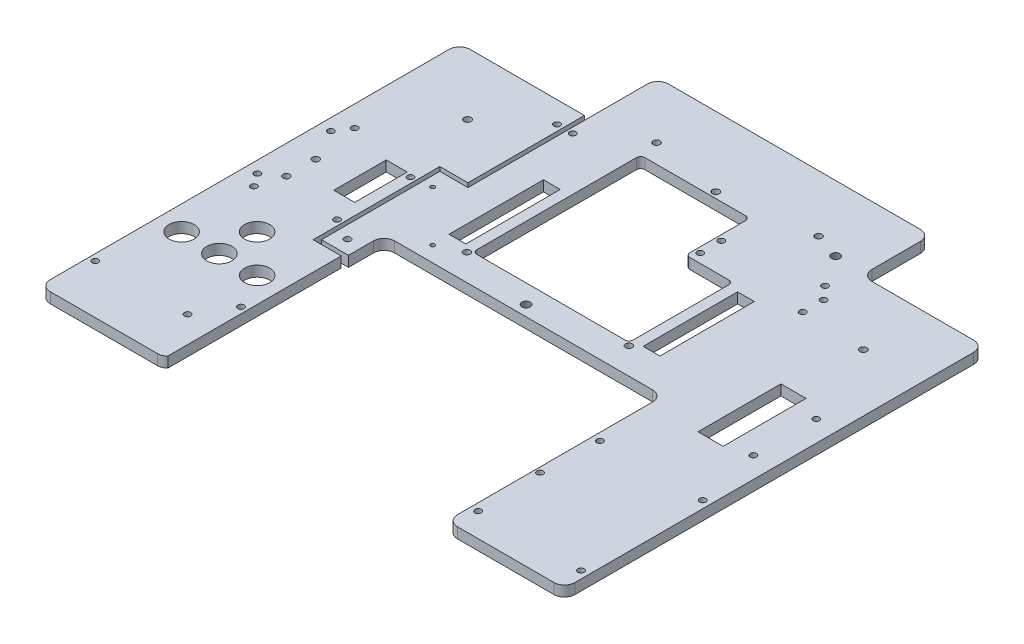
from build123d import *

# Parameters (mm, degrees)
SKETCH_1_W           = 250
SKETCH_1_H           = 200
EXTRUDE_1_DEPTH      = 5
SKETCH_16_R          = 5
CUT_EXTRUDE_11_DEPTH = 11
SKETCH_20_R          = 1.5
CUT_EXTRUDE_15_DEPTH = 15
SKETCH_23_W          = 10
SKETCH_23_H          = 25
CUT_EXTRUDE_18_DEPTH = 10
SKETCH_26_W          = 80
SKETCH_26_H          = 5
EXTRUDE_2_DEPTH      = 33
SKETCH_19_R          = 1.5
CUT_EXTRUDE_14_DEPTH = 15
SKETCH_29_R          = 5
EXTRUDE_5_DEPTH      = 5
SKETCH_30_R          = 1.5
CUT_EXTRUDE_22_DEPTH = 183.589703981
SKETCH_33_R          = 1.5
CUT_EXTRUDE_26_DEPTH = 183.589703981
SKETCH_34_R          = 1.5
CUT_EXTRUDE_27_DEPTH = 10
SKETCH_35_R          = 1.5
CUT_EXTRUDE_28_DEPTH = 10
SKETCH_38_W          = 133
SKETCH_38_H          = 136
CUT_EXTRUDE_31_DEPTH = 10
SKETCH_39_R          = 1.5
CUT_EXTRUDE_32_DEPTH = 183.589703981
SKETCH_40_W          = 21.381304467
SKETCH_40_H          = 33.524264595
SKETCH_40_W_2        = 44.068617219
SKETCH_40_H_2        = 35.466306567
CUT_EXTRUDE_33_DEPTH = 10
FILLET_3_R           = 5
SKETCH_42_W          = 12
SKETCH_42_H          = 39.511138376
CUT_EXTRUDE_35_DEPTH = 10
CUT_EXTRUDE_36_DEPTH = 10
SKETCH_44_R          = 1.5
CUT_EXTRUDE_37_DEPTH = 10
SKETCH_45_R          = 1.5
CUT_EXTRUDE_38_DEPTH = 10
SKETCH_50_R          = 1.5
CUT_EXTRUDE_41_DEPTH = 5
SKETCH_53_R          = 1
SKETCH_53_R_2        = 1.5
CUT_EXTRUDE_44_DEPTH = 5
SKETCH_56_R          = 1.5
CUT_EXTRUDE_46_DEPTH = 10
SKETCH_57_R          = 1.65
CUT_EXTRUDE_48_DEPTH = 5
SKETCH_59_R          = 1.6
CUT_EXTRUDE_50_DEPTH = 5
SKETCH_60_R          = 6
CUT_EXTRUDE_52_DEPTH = 5
SKETCH_61_W          = 33
SKETCH_61_H          = 5
EXTRUDE_7_DEPTH      = 27.922659337
SKETCH_62_W          = 33
SKETCH_62_H          = 5
EXTRUDE_8_DEPTH      = 38.458645
SKETCH_65_R          = 1.6
CUT_EXTRUDE_53_DEPTH = 5
CUT_EXTRUDE_54_DEPTH = 5
FILLET_6_R           = 5
CUT_EXTRUDE_57_DEPTH = 5
FILLET_8_R           = 2
SKETCH_69_W          = 8
SKETCH_69_H          = 45
CUT_EXTRUDE_58_DEPTH = 5


with BuildPart() as part:
    # 草图1 → 凸台-拉伸1 (new body)
    with BuildSketch(Plane(origin=(0, 0, 0), x_dir=(1, 0, 0), z_dir=(0, 1, 0))):
        Rectangle(SKETCH_1_W, SKETCH_1_H)
    extrude(amount=EXTRUDE_1_DEPTH)

    # 草图16 → 切除-拉伸11 (cut)
    with BuildSketch(Plane(origin=(0, 5, 0), x_dir=(1, 0, 0), z_dir=(0, 1, 0))):
        with Locations(Location((-9.5, -74.327812884, 0), (0, 0, 270))):
            Circle(SKETCH_16_R)
    extrude(amount=-CUT_EXTRUDE_11_DEPTH, mode=Mode.SUBTRACT)

    # 草图20 → 切除-拉伸15 (cut)
    with BuildSketch(Plane(origin=(0, 5, 0), x_dir=(1, 0, 0), z_dir=(0, 1, 0))):
        with Locations(Location((-68.353884334, -60.793566597, 0), (0, 0, 270))):
            Circle(SKETCH_20_R)
    extrude(amount=-CUT_EXTRUDE_15_DEPTH, mode=Mode.SUBTRACT)

    # 草图23 → 切除-拉伸18 (cut)
    with BuildSketch(Plane(origin=(0, 5, 0), x_dir=(1, 0, 0), z_dir=(0, 1, 0))):
        with Locations((-89.341476852, 21.910910173)):
            Rectangle(SKETCH_23_W, SKETCH_23_H)
    extrude(amount=-CUT_EXTRUDE_18_DEPTH, mode=Mode.SUBTRACT)

    # 草图26 → 凸台-拉伸2 (add)
    with BuildSketch(Plane(origin=(0, 0, -100), x_dir=(-1, 0, 0), z_dir=(0, 0, -1))):
        with Locations((11.912775293, 2.5)):
            Rectangle(SKETCH_26_W, SKETCH_26_H)
    extrude(amount=EXTRUDE_2_DEPTH)

    # 草图19 → 切除-拉伸14 (cut)
    with BuildSketch(Plane(origin=(0, 5, 0), x_dir=(1, 0, 0), z_dir=(0, 1, 0))):
        with Locations(Location((115, 30, 0), (0, 0, 270))):
            Circle(SKETCH_19_R)
        with Locations(Location((115, 0, 0), (0, 0, 270))):
            Circle(SKETCH_19_R)
        with Locations(Location((-115, 40, 0), (0, 0, 270))):
            Circle(SKETCH_19_R)
        with Locations(Location((-115, -8, 0), (0, 0, 270))):
            Circle(SKETCH_19_R)
        with Locations(Location((62.145255031, -58, 0), (0, 0, 270))):
            Circle(SKETCH_19_R)
    extrude(amount=-CUT_EXTRUDE_14_DEPTH, mode=Mode.SUBTRACT)

    # 草图29 → 凸台-拉伸5 (add)
    with BuildSketch(Plane(origin=(0, 5, 0), x_dir=(1, 0, 0), z_dir=(0, 1, 0))):
        with Locations((-9.5, -74.327812884)):
            Circle(SKETCH_29_R)
    extrude(amount=-EXTRUDE_5_DEPTH)

    # 草图30 → 切除-拉伸22 (cut, through all)
    with BuildSketch(Plane(origin=(0, 5, 0), x_dir=(1, 0, 0), z_dir=(0, 1, 0))):
        with Locations(Location((38.011637907, -60, 0), (0, 0, 270))):
            Circle(SKETCH_30_R)
        with Locations(Location((35.309361312, -73.585261849, 0), (0, 0, 270))):
            Circle(SKETCH_30_R)
        with Locations(Location((27.61392864, -85.102290732, 0), (0, 0, 270))):
            Circle(SKETCH_30_R)
        with Locations(Location((16.096899756, -92.797723404, 0), (0, 0, 270))):
            Circle(SKETCH_30_R)
        with Locations(Location((2.511637907, -95.5, 0), (0, 0, 270))):
            Circle(SKETCH_30_R)
        with Locations(Location((-11.073623941, -92.797723404, 0), (0, 0, 270))):
            Circle(SKETCH_30_R)
        with Locations(Location((-22.590652825, -85.102290732, 0), (0, 0, 270))):
            Circle(SKETCH_30_R)
        with Locations(Location((-30.286085497, -73.585261849, 0), (0, 0, 270))):
            Circle(SKETCH_30_R)
        with Locations(Location((-32.988362093, -60, 0), (0, 0, 270))):
            Circle(SKETCH_30_R)
        with Locations(Location((-30.286085497, -46.414738151, 0), (0, 0, 270))):
            Circle(SKETCH_30_R)
        with Locations(Location((-22.590652825, -34.897709268, 0), (0, 0, 270))):
            Circle(SKETCH_30_R)
        with Locations(Location((-11.073623941, -27.202276596, 0), (0, 0, 270))):
            Circle(SKETCH_30_R)
        with Locations(Location((2.511637907, -24.5, 0), (0, 0, 270))):
            Circle(SKETCH_30_R)
        with Locations(Location((16.096899756, -27.202276596, 0), (0, 0, 270))):
            Circle(SKETCH_30_R)
        with Locations(Location((27.61392864, -34.897709268, 0), (0, 0, 270))):
            Circle(SKETCH_30_R)
        with Locations(Location((35.309361312, -46.414738151, 0), (0, 0, 270))):
            Circle(SKETCH_30_R)
    extrude(amount=-CUT_EXTRUDE_22_DEPTH, mode=Mode.SUBTRACT)

    # 草图33 → 切除-拉伸26 (cut, through all)
    with BuildSketch(Plane(origin=(0, 5, 0), x_dir=(1, 0, 0), z_dir=(0, 1, 0))):
        with Locations(Location((67.652849671, 70.854820312, 0), (0, 0, 270))):
            Circle(SKETCH_33_R)
        with Locations(Location((67.652849671, 80.854820312, 0), (0, 0, 270))):
            Circle(SKETCH_33_R)
        with Locations(Location((18.852849671, 80.854820312, 0), (0, 0, 270))):
            Circle(SKETCH_33_R)
        with Locations(Location((18.852849671, 70.854820312, 0), (0, 0, 270))):
            Circle(SKETCH_33_R)
    extrude(amount=-CUT_EXTRUDE_26_DEPTH, mode=Mode.SUBTRACT)

    # 草图34 → 切除-拉伸27 (cut)
    with BuildSketch(Plane(origin=(0, 5, 0), x_dir=(1, 0, 0), z_dir=(0, 1, 0))):
        with Locations(Location((-122, -76.6, 0), (0, 0, 270))):
            Circle(SKETCH_34_R)
        with Locations(Location((-78, -76.6, 0), (0, 0, 270))):
            Circle(SKETCH_34_R)
    extrude(amount=-CUT_EXTRUDE_27_DEPTH, mode=Mode.SUBTRACT)

    # 草图35 → 切除-拉伸28 (cut)
    with BuildSketch(Plane(origin=(0, 5, 0), x_dir=(1, 0, 0), z_dir=(0, 1, 0))):
        with Locations(Location((-68.353884334, 89.793566597, 0), (0, 0, 270))):
            Circle(SKETCH_35_R)
        with Locations(Location((62.145255031, 87, 0), (0, 0, 270))):
            Circle(SKETCH_35_R)
    extrude(amount=-CUT_EXTRUDE_28_DEPTH, mode=Mode.SUBTRACT)

    # 草图38 → 切除-拉伸31 (cut)
    with BuildSketch(Plane(origin=(0, 5, 0), x_dir=(1, 0, 0), z_dir=(0, 1, 0))):
        with Locations((2.511637907, -65)):
            Rectangle(SKETCH_38_W, SKETCH_38_H)
    extrude(amount=-CUT_EXTRUDE_31_DEPTH, mode=Mode.SUBTRACT)

    # 草图39 → 切除-拉伸32 (cut, through all)
    with BuildSketch(Plane(origin=(0, 5, 0), x_dir=(1, 0, 0), z_dir=(0, 1, 0))):
        with Locations(Location((71.352890761, -58, 0), (0, 0, 270))):
            Circle(SKETCH_39_R)
    extrude(amount=-CUT_EXTRUDE_32_DEPTH, mode=Mode.SUBTRACT)

    # 草图40 → 切除-拉伸33 (cut)
    with BuildSketch(Plane(origin=(0, 5, 0), x_dir=(1, 0, 0), z_dir=(0, 1, 0))):
        with Locations((-46.22212306, 116.762132298)):
            Rectangle(SKETCH_40_W, SKETCH_40_H)
        with Locations((62.589055251, 117.733153284)):
            Rectangle(SKETCH_40_W_2, SKETCH_40_H_2)
    extrude(amount=-CUT_EXTRUDE_33_DEPTH, mode=Mode.SUBTRACT)

    # 圆角3
    fillet_3_edges = [part.edges().sort_by_distance(p)[0] for p in [
        (69.011637907, 2.5, 100),
        (69.011637907, 2.5, -3),
        (-63.988362093, 2.5, 100),
        (-63.988362093, 2.5, -3),
        (125, 2.5, 100),
        (-125, 2.5, 100),
        (-125, 2.5, -100),
        (125, 2.5, -100),
    ]]
    fillet(fillet_3_edges, radius=FILLET_3_R)

    # 草图42 → 切除-拉伸35 (cut)
    with BuildSketch(Plane(origin=(0, 5, 0), x_dir=(1, 0, 0), z_dir=(0, 1, 0))):
        with Locations((98.103934789, 16.274145881)):
            Rectangle(SKETCH_42_W, SKETCH_42_H)
    extrude(amount=-CUT_EXTRUDE_35_DEPTH, mode=Mode.SUBTRACT)

    # 草图43 → 切除-拉伸36 (cut)
    with BuildSketch(Plane(origin=(0, 5, 0), x_dir=(1, 0, 0), z_dir=(0, 1, 0))):
        Polygon((-65.454130163, 100), (-65.454130163, 44.465322203), (-78.855525146, 44.465322203), (-78.855525146, -15.933068336), (-65.454130163, -15.933068336), (-65.454130163, -100.006991686), (-63.454130163, -100.006991686), (-63.454130163, -13.933068336), (-76.855525146, -13.933068336), (-76.855525146, 42.465322203), (-63.454130163, 42.465322203), (-63.454130163, 100), align=None)
    extrude(amount=-CUT_EXTRUDE_36_DEPTH, mode=Mode.SUBTRACT)


with BuildPart() as cut_extrude_36_piece_1:
    # of the separate pieces the step leaves, piece 1, a body of its own (cut_extrude_36_pieces)
    add(part.part.solids().sort_by_distance((-63.454130163, 5, -100))[0])

    # 草图44 → 切除-拉伸37 (cut)
    with BuildSketch(Plane(origin=(0, 5, 0), x_dir=(1, 0, 0), z_dir=(0, 1, 0))):
        with Locations(Location((-60.864682609, 89.793566597, 0), (0, 0, 270))):
            Circle(SKETCH_44_R)
    extrude(amount=-CUT_EXTRUDE_37_DEPTH, mode=Mode.SUBTRACT)

    # 草图45 → 切除-拉伸38 (cut)
    with BuildSketch(Plane(origin=(0, 5, 0), x_dir=(1, 0, 0), z_dir=(0, 1, 0))):
        with Locations(Location((-70.874244833, -7.534328491, 0), (0, 0, 270))):
            Circle(SKETCH_45_R)
    extrude(amount=-CUT_EXTRUDE_38_DEPTH, mode=Mode.SUBTRACT)

    # 草图50 → 切除-拉伸41 (cut)
    with BuildSketch(Plane(origin=(0, 5, 0), x_dir=(1, 0, 0), z_dir=(0, 1, 0))):
        with Locations(Location((-0.072615935, 51.462867156, 0), (0, 0, 270))):
            Circle(SKETCH_50_R)
    extrude(amount=-CUT_EXTRUDE_41_DEPTH, mode=Mode.SUBTRACT)


with BuildPart() as cut_extrude_36_piece_2:
    # of the separate pieces the step leaves, piece 2, a body of its own (cut_extrude_36_pieces)
    add(part.part.solids().sort_by_distance((-120, 0, -100))[0])


with BuildPart() as cut_extrude_44_tool:
    # 草图53 → 切除-拉伸44 (new body)
    with BuildSketch(Plane(origin=(0, 5, 0), x_dir=(1, 0, 0), z_dir=(0, 1, 0))):
        with Locations(Location((-72.118454967, 34.317741468, 0), (0, 0, 270))):
            Circle(SKETCH_53_R)
        with Locations(Location((-48.118454967, 10.317741468, 0), (0, 0, 270))):
            Circle(SKETCH_53_R)
        with Locations(Location((-119.441436652, 33.090151529, 0), (0, 0, 270))):
            Circle(SKETCH_53_R_2)
        with Locations(Location((-119.441436652, -1.909848471, 0), (0, 0, 270))):
            Circle(SKETCH_53_R_2)
        with Locations(Location((-81.441436652, -1.909848471, 0), (0, 0, 270))):
            Circle(SKETCH_53_R_2)
        with Locations(Location((-81.441436652, 33.090151529, 0), (0, 0, 270))):
            Circle(SKETCH_53_R_2)
    extrude(amount=-CUT_EXTRUDE_44_DEPTH)


with BuildPart() as cut_extrude_36_piece_1_1:
    add(cut_extrude_36_piece_1.part)

    # 切除-拉伸44: cut by cut_extrude_44_tool
    add(cut_extrude_44_tool.part, mode=Mode.SUBTRACT)

    # 草图56 → 切除-拉伸46 (cut)
    with BuildSketch(Plane(origin=(0, 5, 0), x_dir=(1, 0, 0), z_dir=(0, 1, 0))):
        with Locations(Location((72.5, -30.611943243, 0), (0, 0, 270))):
            Circle(SKETCH_56_R)
        with Locations(Location((121.5, -30.611943243, 0), (0, 0, 270))):
            Circle(SKETCH_56_R)
        with Locations(Location((72.5, -88.611943243, 0), (0, 0, 270))):
            Circle(SKETCH_56_R)
        with Locations(Location((121.5, -88.611943243, 0), (0, 0, 270))):
            Circle(SKETCH_56_R)
    extrude(amount=-CUT_EXTRUDE_46_DEPTH, mode=Mode.SUBTRACT)


with BuildPart() as cut_extrude_36_piece_2_1:
    add(cut_extrude_36_piece_2.part)

    # 切除-拉伸44: cut by cut_extrude_44_tool
    add(cut_extrude_44_tool.part, mode=Mode.SUBTRACT)


with BuildPart() as cut_extrude_48_tool:
    # 草图57 → 切除-拉伸48 (new body)
    with BuildSketch(Plane(origin=(0, 5, 0), x_dir=(1, 0, 0), z_dir=(0, 1, 0))):
        with Locations(Location((-91.663866667, 70.484221732, 0), (0, 0, 270))):
            Circle(SKETCH_57_R)
        with Locations(Location((-2.72049869, 99.833332382, 0), (0, 0, 270))):
            Circle(SKETCH_57_R)
        with Locations(Location((97.615241729, 69.834359642, 0), (0, 0, 270))):
            Circle(SKETCH_57_R)
    extrude(amount=-CUT_EXTRUDE_48_DEPTH)


with BuildPart() as cut_extrude_36_piece_1_2:
    add(cut_extrude_36_piece_1_1.part)

    # 切除-拉伸48: cut by cut_extrude_48_tool
    add(cut_extrude_48_tool.part, mode=Mode.SUBTRACT)

    # 草图61 → 凸台-拉伸7 (add)
    with BuildSketch(Plane.ZY.offset(35.531470826)):
        with Locations((-116.5, 2.5)):
            Rectangle(SKETCH_61_W, SKETCH_61_H)
    extrude(amount=EXTRUDE_7_DEPTH)

    # 草图62 → 凸台-拉伸8 (add)
    with BuildSketch(Plane(origin=(28.087224707, 0, 0), x_dir=(0, 0, -1), z_dir=(1, 0, 0))):
        with Locations((116.5, 2.5)):
            Rectangle(SKETCH_62_W, SKETCH_62_H)
    extrude(amount=EXTRUDE_8_DEPTH)

    # 草图65 → 切除-拉伸53 (cut)
    with BuildSketch(Plane(origin=(0, 5, 0), x_dir=(1, 0, 0), z_dir=(0, 1, 0))):
        with Locations(Location((40.145869837, 105.95, 0), (0, 0, 270))):
            Circle(SKETCH_65_R)
        with Locations(Location((-37.054130163, 105.95, 0), (0, 0, 270))):
            Circle(SKETCH_65_R)
        with Locations(Location((40.145869837, 15.55, 0), (0, 0, 270))):
            Circle(SKETCH_65_R)
        with Locations(Location((-37.054130163, 15.55, 0), (0, 0, 270))):
            Circle(SKETCH_65_R)
    extrude(amount=-CUT_EXTRUDE_53_DEPTH, mode=Mode.SUBTRACT)

    # 草图66 → 切除-拉伸54 (cut)
    with BuildSketch(Plane(origin=(0, 5, 0), x_dir=(1, 0, 0), z_dir=(0, 1, 0))):
        Polygon((-1.79694331, 6.108213124), (-1.762878179, 6.10065784), (-1.728667232, 6.093703474), (-1.694342338, 6.087334848), (-1.659919017, 6.081575686), (-1.625388998, 6.076417494), (-1.590782072, 6.071861367), (-1.556098711, 6.067906845), (-1.521361624, 6.064562147), (-1.486556848, 6.061826853), (-1.451721729, 6.059694009), (-1.416847788, 6.058170953), (-1.381957838, 6.05725822), (-1.347029531, 6.056955281), (-1.312140827, 6.057248035), (-1.277251642, 6.058174137), (-1.242369932, 6.059695506), (-1.207535176, 6.061820117), (-1.172735996, 6.064563186), (-1.13800006, 6.067910177), (-1.10330875, 6.07186038), (-1.068701644, 6.076414317), (-1.034171754, 6.08157213), (-0.999754467, 6.087334288), (-0.965430228, 6.09370053), (-0.931227643, 6.10065587), (-0.897131611, 6.10821524), (-0.863197841, 6.116356795), (-0.829399027, 6.125102757), (-0.795775614, 6.134423394), (-0.762313797, 6.14434134), (-0.729010618, 6.154833739), (-0.695899969, 6.165908489), (-0.663000941, 6.177565844), (-0.630302559, 6.189790524), (-0.597838814, 6.20258298), (-0.565573387, 6.215942728), (-0.533584706, 6.229855443), (-0.501807745, 6.244343312), (-0.470298988, 6.259360981), (-0.439070132, 6.274939575), (-0.408111242, 6.291055676), (-0.377418121, 6.307709694), (-0.347037802, 6.324901787), (-0.31696164, 6.342616706), (-0.287216174, 6.360854802), (-0.257757737, 6.379608044), (-0.228660825, 6.398877422), (-0.199904331, 6.418639369), (-0.171470717, 6.438916939), (-0.143408814, 6.459680042), (-0.115721881, 6.480928955), (-0.088402102, 6.50265589), (-0.061469403, 6.524868329), (-0.034927077, 6.547528827), (-0.008781242, 6.570667503), (0.016960611, 6.594246269), (0.042267855, 6.618273447), (0.067178104, 6.642740856), (0.091628764, 6.667634189), (0.115661735, 6.692952425), (0.139243861, 6.718688786), (0.162370284, 6.744827968), (0.185051815, 6.771377511), (0.20725369, 6.798314825), (0.228981761, 6.825624463), (0.250221337, 6.853322454), (0.270980852, 6.881377484), (0.291268328, 6.909797597), (0.31102815, 6.938567929), (0.33030063, 6.967673043), (0.349052702, 6.997112912), (0.36728836, 7.026872581), (0.384995857, 7.056944287), (0.402199978, 7.087335621), (0.418847599, 7.118009097), (0.434975966, 7.148963758), (0.450532108, 7.180208687), (0.465561248, 7.211712549), (0.480042893, 7.243475149), (0.493974256, 7.275496992), (0.507310026, 7.307732572), (0.520126145, 7.340219536), (0.532342375, 7.372912378), (0.543998773, 7.405811498), (0.555077631, 7.4389162), (0.565560495, 7.472204374), (0.575479033, 7.505676066), (0.584794742, 7.539307571), (0.593544525, 7.573107246), (0.601693052, 7.607044826), (0.609246934, 7.641127206), (0.616197495, 7.67533215), (0.622567444, 7.709651437), (0.628326888, 7.744078481), (0.633485031, 7.778604774), (0.638046696, 7.813207901), (0.641999404, 7.847895012), (0.645347884, 7.88263624), (0.648079753, 7.917446185), (0.650216303, 7.952279857), (0.651740965, 7.987151914), (0.652650279, 8.022047498), (0.652954747, 8.056950637), (0.652650557, 8.091854861), (0.651734232, 8.126743916), (0.650216594, 8.161626042), (0.648072912, 8.196462448), (0.645341018, 8.23126148), (0.642005796, 8.26600704), (0.638055514, 8.300692296), (0.633492196, 8.335294404), (0.628326645, 8.369820206), (0.622558564, 8.404247351), (0.616204145, 8.438567707), (0.609246987, 8.472773577), (0.601685035, 8.506850549), (0.593545755, 8.540797794), (0.584801739, 8.574585405), (0.575471811, 8.608228035), (0.565561155, 8.641695344), (0.555086162, 8.674994101), (0.543999782, 8.708088139), (0.532334793, 8.740990994), (0.520119401, 8.773687389), (0.507310105, 8.806163001), (0.493965567, 8.838416583), (0.480051036, 8.870426245), (0.465568832, 8.902191489), (0.450539705, 8.933696671), (0.434976502, 8.964927186), (0.41883937, 8.995897998), (0.40220044, 9.026569963), (0.385002551, 9.056952221), (0.367295414, 9.087035731), (0.349053483, 9.116790561), (0.330300251, 9.146232234), (0.311028877, 9.175336623), (0.291261264, 9.204104835), (0.270989286, 9.232521144), (0.250222151, 9.260577511), (0.228983041, 9.288266178), (0.207246818, 9.315587943), (0.185043539, 9.342526574), (0.16237776, 9.369074559), (0.139244517, 9.395208679), (0.115661819, 9.420952447), (0.091631014, 9.44626719), (0.067178847, 9.471167923), (0.042268698, 9.495632311), (0.016961556, 9.519659081), (-0.008780386, 9.543241747), (-0.034925112, 9.566371504), (-0.061476905, 9.589041421), (-0.088400942, 9.611243587), (-0.115714562, 9.632969848), (-0.143415897, 9.654220645), (-0.171469193, 9.674988053), (-0.199897009, 9.695256538), (-0.228659768, 9.715025574), (-0.257764546, 9.734288269), (-0.287206687, 9.753044563), (-0.316970112, 9.771277942), (-0.347045284, 9.789005045), (-0.377417731, 9.806193547), (-0.408110248, 9.822845146), (-0.43906361, 9.838966044), (-0.470304096, 9.854541221), (-0.501806095, 9.869570336), (-0.533584142, 9.884046132), (-0.565573508, 9.897968216), (-0.597829918, 9.911313576), (-0.630301745, 9.924112264), (-0.663000461, 9.936342078), (-0.69590672, 9.947986927), (-0.729017524, 9.959062141), (-0.762305966, 9.969559911), (-0.795767488, 9.979472725), (-0.829397442, 9.988800057), (-0.86320281, 9.997541998), (-0.89713071, 10.005682945), (-0.93122647, 10.013246319), (-0.965429501, 10.02020058), (-0.999746945, 10.026569107), (-1.034177713, 10.032328601), (-1.068702151, 10.037486253), (-1.103316521, 10.042042945), (-1.137992438, 10.045996902), (-1.172735572, 10.049342147), (-1.2075342, 10.052084577), (-1.242361967, 10.054209872), (-1.277251277, 10.055732899), (-1.312148674, 10.056645964), (-1.347036937, 10.056948372), (-1.381956005, 10.056648569), (-1.416845091, 10.055729917), (-1.451711902, 10.05420835), (-1.486548619, 10.052076315), (-1.521360738, 10.049340868), (-1.556097139, 10.045993883), (-1.590780534, 10.042043576), (-1.625395654, 10.037482293), (-1.659917632, 10.032324142), (-1.694350185, 10.026569639), (-1.728666971, 10.02020353), (-1.762869091, 10.013248184), (-1.796942307, 10.005688511), (-1.830878507, 9.997539305), (-1.864682807, 9.988801099), (-1.898321588, 9.979480434), (-1.931792715, 9.969562843), (-1.965070747, 9.959070345), (-1.998168361, 9.947995189), (-2.031088339, 9.936338344), (-2.063781134, 9.92411359), (-2.096265934, 9.91131373), (-2.128508446, 9.897961128), (-2.160521907, 9.884041058), (-2.192283296, 9.869568583), (-2.22377736, 9.854535118), (-2.255019049, 9.838972063), (-2.285987354, 9.822848403), (-2.316663713, 9.806194163), (-2.347036113, 9.789002197), (-2.377104828, 9.771286947), (-2.406889973, 9.753041693), (-2.436323632, 9.734295806), (-2.465438, 9.715026893), (-2.494192734, 9.695257238), (-2.522605061, 9.67498707), (-2.550672786, 9.654223811), (-2.578359953, 9.632974901), (-2.605689143, 9.61124064), (-2.632620011, 9.589043312), (-2.659154623, 9.566367577), (-2.685310032, 9.543244396), (-2.711042448, 9.519657355), (-2.736364591, 9.495630374), (-2.761252153, 9.471170582), (-2.785727593, 9.446269893), (-2.809745198, 9.420951453), (-2.833343022, 9.395207849), (-2.856474799, 9.369068738), (-2.87912573, 9.342526473), (-2.901335291, 9.315589029), (-2.923063697, 9.288271711), (-2.944312484, 9.260581526), (-2.96507955, 9.232518912), (-2.985342243, 9.204106387), (-3.005117332, 9.175343709), (-3.024374545, 9.146230941), (-3.043143612, 9.116791297), (-3.061377408, 9.087031604), (-3.079092693, 9.056952084), (-3.096274126, 9.026568367), (-3.112936647, 8.995895088), (-3.129042204, 8.964939659), (-3.144628844, 8.933695135), (-3.159660073, 8.902191766), (-3.174147411, 8.870421324), (-3.18806367, 8.838414649), (-3.201406995, 8.806171252), (-3.214209838, 8.773684578), (-3.226431895, 8.740991347), (-3.238074882, 8.708085064), (-3.249151785, 8.674987322), (-3.25965733, 8.641691998), (-3.269568179, 8.608220669), (-3.278899493, 8.574588906), (-3.287635674, 8.540796501), (-3.295782664, 8.506851915), (-3.303343665, 8.472777081), (-3.310301908, 8.438572239), (-3.316656963, 8.404252288), (-3.322431639, 8.369817996), (-3.327581761, 8.335299512), (-3.332128625, 8.300688738), (-3.336081002, 8.266009074), (-3.339439358, 8.231260526), (-3.342170797, 8.196465478), (-3.344305584, 8.161624331), (-3.345816975, 8.126752098), (-3.346731877, 8.091856588), (-3.347038214, 8.056953008), (-3.346732387, 8.022049229), (-3.345815935, 7.987152255), (-3.344306108, 7.952278149), (-3.342162094, 7.91744919), (-3.339445769, 7.882634996), (-3.336089496, 7.847896609), (-3.332137351, 7.813211327), (-3.327590888, 7.778602457), (-3.322425238, 7.744084106), (-3.316665404, 7.709649619), (-3.310302837, 7.675329154), (-3.303336041, 7.641130143), (-3.295791881, 7.607045955), (-3.287635041, 7.573105928), (-3.278883104, 7.539318678), (-3.269568541, 7.505676252), (-3.259650668, 7.472208847), (-3.249160217, 7.438916871), (-3.238073697, 7.405815846), (-3.226431756, 7.372913296), (-3.214216603, 7.340216438), (-3.201414856, 7.307733476), (-3.188056716, 7.275487164), (-3.1741479, 7.243485495), (-3.159660208, 7.211712727), (-3.144628992, 7.180207051), (-3.129050522, 7.148968883), (-3.112930414, 7.118013665), (-3.096266806, 7.087341373), (-3.079101714, 7.056944181), (-3.061376913, 7.026875805), (-3.043142665, 6.997121077), (-3.024383711, 6.967671877), (-3.005126079, 6.938567205), (-2.985343097, 6.909799021), (-2.965086351, 6.881375463), (-2.944311664, 6.85332668), (-2.923057061, 6.825629891), (-2.901328518, 6.798308461), (-2.879127232, 6.77137754), (-2.856474724, 6.744829731), (-2.833343349, 6.71869517), (-2.809745515, 6.692951434), (-2.78572798, 6.667636867), (-2.761252765, 6.642735829), (-2.736365429, 6.618271976), (-2.711043157, 6.594244773), (-2.685302973, 6.570670046), (-2.659163939, 6.547532448), (-2.632621927, 6.524862428), (-2.605690437, 6.502660396), (-2.578369236, 6.480926351), (-2.550665704, 6.459683208), (-2.522604955, 6.438915934), (-2.494186349, 6.418655256), (-2.465431713, 6.398870727), (-2.436316924, 6.379607898), (-2.406882593, 6.360859625), (-2.377113689, 6.342618024), (-2.347038409, 6.324899069), (-2.316665969, 6.307710102), (-2.2859945, 6.291051563), (-2.255027998, 6.274938175), (-2.223777269, 6.259362862), (-2.192291002, 6.244341407), (-2.16051492, 6.229857953), (-2.128500305, 6.215943451), (-2.096251913, 6.202590513), (-2.063781951, 6.189791617), (-2.03108882, 6.177562111), (-1.998176511, 6.165916948), (-1.96507921, 6.154841913), (-1.931785646, 6.144344075), (-1.898329344, 6.134423879), (-1.864684491, 6.12509635), (-1.830871006, 6.116369436), align=None)
        Polygon((50.500860049, 101.188897297), (50.511936987, 101.155793605), (50.523594061, 101.122890855), (50.535812644, 101.090189294), (50.548611758, 101.057718475), (50.561953956, 101.025463992), (50.57588443, 100.993462502), (50.590354459, 100.961692297), (50.605390514, 100.930182831), (50.620959268, 100.898949448), (50.63708307, 100.867991853), (50.653735648, 100.837295491), (50.670921814, 100.806942261), (50.688636854, 100.776857715), (50.706881559, 100.747101451), (50.725629756, 100.717666365), (50.744896344, 100.68855226), (50.764674171, 100.659781584), (50.784937258, 100.631362132), (50.805707958, 100.60329361), (50.826956865, 100.57560621), (50.84868388, 100.548292484), (50.870881553, 100.521352531), (50.893557828, 100.4948235), (50.916678588, 100.468661137), (50.940267171, 100.442939646), (50.964293184, 100.41761472), (50.988760944, 100.392731012), (51.01365496, 100.368244018), (51.038979746, 100.344213289), (51.064716776, 100.320646521), (51.09085448, 100.297514064), (51.117397078, 100.274853117), (51.144336625, 100.252626529), (51.171644211, 100.230901745), (51.199342087, 100.209671019), (51.227403683, 100.188897446), (51.255825869, 100.168625777), (51.284578942, 100.148863855), (51.313692505, 100.129596386), (51.343133429, 100.110853613), (51.37289377, 100.092598387), (51.402970493, 100.074882906), (51.433355952, 100.057692369), (51.464028094, 100.041049422), (51.494982797, 100.024924315), (51.526227809, 100.009339299), (51.557741076, 99.99431702), (51.589503578, 99.979827924), (51.621500909, 99.96590946), (51.653751694, 99.952561381), (51.686233386, 99.939769082), (51.718931183, 99.927540212), (51.751837932, 99.915897219), (51.784938536, 99.9048254), (51.818232994, 99.894324757), (51.851702879, 99.884410434), (51.885344665, 99.875097382), (51.919135506, 99.866348648), (51.953072173, 99.858201531), (51.987147214, 99.850656128), (52.021360039, 99.843667741), (52.055670856, 99.837326313), (52.090104754, 99.831556997), (52.124632426, 99.82639744), (52.159235149, 99.821840437), (52.193916846, 99.81790084), (52.228662023, 99.814534146), (52.263460297, 99.811800103), (52.298300195, 99.809676509), (52.333170544, 99.808163513), (52.368067321, 99.807238814), (52.402972297, 99.806932459), (52.437874298, 99.807244596), (52.472773125, 99.808160326), (52.507638979, 99.809680042), (52.542490584, 99.811810949), (52.577290492, 99.81453864), (52.612027923, 99.817893063), (52.646721108, 99.821844172), (52.681321622, 99.826392608), (52.715848187, 99.831545576), (52.750267478, 99.837318418), (52.784593999, 99.843681137), (52.818801873, 99.85064898), (52.85287953, 99.858192295), (52.886820013, 99.86634843), (52.920611753, 99.875087734), (52.95425475, 99.884410206), (52.987723027, 99.894323643), (53.021009135, 99.904828143), (53.054109152, 99.915908856), (53.087019056, 99.92754348), (53.119698267, 99.939762361), (53.152183936, 99.952557552), (53.184438814, 99.965929549), (53.216447409, 99.979833849), (53.248210411, 99.994322602), (53.279715954, 100.009343807), (53.310956886, 100.024919912), (53.341918107, 100.041036215), (53.372599619, 100.057692715), (53.402971523, 100.074882359), (53.433056069, 100.092597399), (53.462804636, 100.110823579), (53.492251243, 100.129597702), (53.521365397, 100.148868015), (53.550124652, 100.168627365), (53.578540279, 100.188883052), (53.606612675, 100.209664877), (53.634292526, 100.230906433), (53.661617476, 100.252637024), (53.688546452, 100.274849745), (53.715093959, 100.297514599), (53.741237944, 100.320654231), (53.766974089, 100.344223991), (53.792287691, 100.368238977), (53.817190222, 100.392721391), (53.841651092, 100.417612027), (53.865678145, 100.442940587), (53.88927079, 100.468662372), (53.912392369, 100.494822574), (53.935060519, 100.521346449), (53.957272306, 100.548293643), (53.978996941, 100.575590054), (54.000250116, 100.603295083), (54.021001141, 100.631342076), (54.041276783, 100.659782837), (54.061053704, 100.688543163), (54.080317497, 100.717660501), (54.099071395, 100.747097551), (54.117315397, 100.776854315), (54.135023625, 100.806946037), (54.152221168, 100.837297873), (54.168871861, 100.867992265), (54.184985892, 100.898954567), (54.200567183, 100.930199628), (54.215581815, 100.961698094), (54.230067136, 100.993456921), (54.243981875, 101.025454301), (54.257341129, 101.057704938), (54.270141174, 101.090208881), (54.282362298, 101.122884427), (54.294005192, 101.155783726), (54.305088285, 101.188891631), (54.315589126, 101.222200989), (54.325499378, 101.255644849), (54.334827379, 101.289290162), (54.343568712, 101.323084827), (54.351712303, 101.357036443), (54.359265007, 101.391100211), (54.366227319, 101.425313381), (54.372587669, 101.459646301), (54.378349189, 101.494054223), (54.383505219, 101.528596845), (54.388062123, 101.563192118), (54.392016768, 101.597884792), (54.395361013, 101.632622815), (54.398106034, 101.667406041), (54.400237324, 101.702264465), (54.401753996, 101.73713104), (54.402667322, 101.772013065), (54.402970051, 101.806925541), (54.402669138, 101.841831118), (54.401757331, 101.876744796), (54.400237467, 101.911599475), (54.398102687, 101.946439954), (54.395360047, 101.981236335), (54.392013172, 102.015981117), (54.388065591, 102.050659353), (54.383509852, 102.08527114), (54.378353309, 102.11980893), (54.37259174, 102.154235523), (54.366232597, 102.18855082), (54.359275781, 102.22274737), (54.351717467, 102.256817775), (54.343569227, 102.290791684), (54.334822522, 102.324587247), (54.325499704, 102.358204169), (54.315582641, 102.391679946), (54.305089267, 102.424962181), (54.294008703, 102.458073373), (54.282359079, 102.490976024), (54.270132749, 102.523655334), (54.257341381, 102.556148404), (54.243980559, 102.588403134), (54.23006871, 102.620404377), (54.215587407, 102.652167281), (54.200562527, 102.683676599), (54.184986323, 102.71491008), (54.16887007, 102.745875026), (54.152213767, 102.776571438), (54.135031228, 102.806917168), (54.117308935, 102.837016713), (54.099067954, 102.866772928), (54.080315934, 102.896200613), (54.06105307, 102.925314669), (54.041278871, 102.954077846), (54.021008431, 102.982504846), (54.000252533, 103.010565721), (53.979003725, 103.03826057), (53.95726926, 103.065574395), (53.935056589, 103.092507096), (53.912395312, 103.119043379), (53.88925563, 103.145183639), (53.86568587, 103.170919784), (53.841659956, 103.196252159), (53.817192097, 103.221128417), (53.792298081, 103.245615411), (53.766973394, 103.26965359), (53.741236364, 103.293220358), (53.715087386, 103.316345514), (53.688544986, 103.339021361), (53.661616416, 103.3612329), (53.634293732, 103.382942982), (53.606610954, 103.40418841), (53.578545633, 103.424962032), (53.550127271, 103.445241103), (53.521363023, 103.465003173), (53.492249558, 103.484278092), (53.462812458, 103.503028264), (53.433059272, 103.521261042), (53.402971472, 103.538984121), (53.372589441, 103.556152259), (53.34192142, 103.572824956), (53.31095152, 103.588927911), (53.279721606, 103.60452763), (53.248211965, 103.61954241), (53.216449562, 103.634038955), (53.184433309, 103.647935316), (53.152190073, 103.661290747), (53.119712304, 103.674097896), (53.087018232, 103.686326716), (53.054111384, 103.69796226), (53.021007352, 103.709056477), (52.987720047, 103.719534673), (52.954250261, 103.729456445), (52.920608475, 103.738769497), (52.886817634, 103.747518231), (52.852881066, 103.755672799), (52.818798574, 103.7632183), (52.784600255, 103.770176689), (52.750263856, 103.776555713), (52.71585221, 103.782317283), (52.681320615, 103.78746199), (52.646717793, 103.792011542), (52.612036294, 103.79596604), (52.577287293, 103.799325333), (52.542492744, 103.802059327), (52.507652846, 103.80418292), (52.472771421, 103.805703514), (52.437878468, 103.806635614), (52.402973393, 103.806934519), (52.368067766, 103.806629881), (52.333180015, 103.805706554), (52.298306908, 103.804201836), (52.263462754, 103.80207083), (52.228662549, 103.799320789), (52.193917668, 103.795966465), (52.159239482, 103.792022608), (52.124631321, 103.787459371), (52.090104656, 103.782298954), (52.055670762, 103.776548659), (52.021355317, 103.770178341), (51.987144014, 103.763232897), (51.95307361, 103.755674584), (51.919125875, 103.747533448), (51.885337662, 103.738779195), (51.85170584, 103.729456574), (51.818230014, 103.719535786), (51.784936752, 103.709053735), (51.751844185, 103.697972923), (51.718941534, 103.6863233), (51.686236051, 103.674089866), (51.653761457, 103.661287076), (51.621506876, 103.647937429), (51.589498083, 103.634018229), (51.557739004, 103.619544326), (51.526233362, 103.604515672), (51.494988706, 103.588939616), (51.464027484, 103.572823313), (51.433353422, 103.556166714), (51.402970344, 103.538977219), (51.372904422, 103.521261931), (51.343133406, 103.503028598), (51.313690821, 103.484276775), (51.284595094, 103.464991315), (51.255828389, 103.445232065), (51.22740139, 103.424961626), (51.199340465, 103.404202002), (51.171649242, 103.382945695), (51.144328313, 103.361237404), (51.117399337, 103.339024682), (51.09085918, 103.31635228), (51.064715196, 103.293212648), (51.038986501, 103.269642789), (51.013665152, 103.245605552), (50.988762819, 103.221138039), (50.964298323, 103.196254902), (50.940263721, 103.17091899), (50.916682251, 103.145197057), (50.893560771, 103.119044305), (50.870881446, 103.092520579), (50.848680834, 103.065573236), (50.826955902, 103.038254475), (50.805695475, 103.010564445), (50.784937, 102.98251755), (50.764683807, 102.954083943), (50.744899338, 102.925316266), (50.725635544, 102.896198929), (50.70687802, 102.866769377), (50.688637842, 102.837020014), (50.670925987, 102.806935792), (50.653739422, 102.776568908), (50.637077752, 102.745889563), (50.620959897, 102.714919861), (50.605382429, 102.6836822), (50.59036015, 102.652168933), (50.575885708, 102.620387609), (50.561963716, 102.588405227), (50.548611714, 102.556139592), (50.535811867, 102.523650549), (50.523590743, 102.490975003), (50.511936476, 102.458060952), (50.500860834, 102.424952948), (50.490364112, 102.39167334), (50.480450037, 102.358222079), (50.47112586, 102.324584167), (50.462373253, 102.2907822), (50.454233585, 102.256845435), (50.446684309, 102.222759268), (50.439721997, 102.188546098), (50.433361944, 102.154235527), (50.427603853, 102.119805206), (50.422436746, 102.085270183), (50.417883567, 102.05067486), (50.413928823, 102.015974736), (50.410580952, 101.981244212), (50.40784681, 101.946438489), (50.405723266, 101.911602315), (50.404191694, 101.876735938), (50.403278072, 101.841831563), (50.402967893, 101.806919186), (50.403276354, 101.77202096), (50.404195808, 101.737122083), (50.405715574, 101.702259954), (50.40784653, 101.667412075), (50.410593192, 101.632637994), (50.413928694, 101.59787846), (50.417880001, 101.563200175), (50.42244309, 101.528580839), (50.427599733, 101.494050499), (50.433354049, 101.459638905), (50.439720444, 101.42530861), (50.44668471, 101.39111196), (50.454227926, 101.357026854), (50.462376661, 101.323090194), (50.471123365, 101.28929463), (50.480449513, 101.255647859), (50.490363246, 101.222201932), align=None)
    extrude(amount=-CUT_EXTRUDE_54_DEPTH, mode=Mode.SUBTRACT)

    # 圆角6
    fillet_6_edges = [cut_extrude_36_piece_1_2.edges().sort_by_distance(p)[0] for p in [
        (-63.454130163, 2.5, -133),
        (66.545869707, 2.5, -100),
        (66.545869707, 2.5, -133),
    ]]
    fillet(fillet_6_edges, radius=FILLET_6_R)

    # 草图68 → 切除-拉伸57 (cut)
    with BuildSketch(Plane(origin=(0, 5, 0), x_dir=(1, 0, 0), z_dir=(0, 1, 0))):
        Polygon((38.795869837, 17), (38.795869837, 66.5), (16.295869837, 66.5), (16.295869837, 97), (-35.704130163, 97), (-35.704130163, 17), align=None)
    extrude(amount=-CUT_EXTRUDE_57_DEPTH, mode=Mode.SUBTRACT)

    # 圆角8
    fillet_8_edges = [cut_extrude_36_piece_1_2.edges().sort_by_distance(p)[0] for p in [
        (16.295869837, 2.5, -66.5),
        (38.795869837, 2.5, -66.5),
        (38.795869837, 2.5, -17),
        (-35.704130163, 2.5, -17),
        (-35.704130163, 2.5, -97),
        (16.295869837, 2.5, -97),
    ]]
    fillet(fillet_8_edges, radius=FILLET_8_R)

    # 草图69 → 切除-拉伸58 (cut)
    with BuildSketch(Plane(origin=(0, 5, 0), x_dir=(1, 0, 0), z_dir=(0, 1, 0))):
        with Locations((-44.704130163, 41.198091072)):
            Rectangle(SKETCH_69_W, SKETCH_69_H)
        with Locations((47.795869837, 41.198091072)):
            Rectangle(SKETCH_69_W, SKETCH_69_H)
    extrude(amount=-CUT_EXTRUDE_58_DEPTH, mode=Mode.SUBTRACT)


with BuildPart() as cut_extrude_36_piece_2_2:
    add(cut_extrude_36_piece_2_1.part)

    # 切除-拉伸48: cut by cut_extrude_48_tool
    add(cut_extrude_48_tool.part, mode=Mode.SUBTRACT)

    # 草图59 → 切除-拉伸50 (cut)
    with BuildSketch(Plane(origin=(0, 5, 0), x_dir=(1, 0, 0), z_dir=(0, 1, 0))):
        with Locations(Location((-111.456761278, 17.926749826, 0), (0, 0, 270))):
            Circle(SKETCH_59_R)
        with Locations(Location((-111.456761278, 3.926749826, 0), (0, 0, 270))):
            Circle(SKETCH_59_R)
    extrude(amount=-CUT_EXTRUDE_50_DEPTH, mode=Mode.SUBTRACT)

    # 草图60 → 切除-拉伸52 (cut)
    with BuildSketch(Plane(origin=(0, 5, 0), x_dir=(1, 0, 0), z_dir=(0, 1, 0))):
        with Locations(Location((-95.454130163, -26, 0), (0, 0, 270))):
            Circle(SKETCH_60_R)
        with Locations(Location((-95.454102769, -44, 0), (0, 0, 270))):
            Circle(SKETCH_60_R)
        with Locations(Location((-113.454102769, -44, 0), (0, 0, 270))):
            Circle(SKETCH_60_R)
        with Locations(Location((-77.454102769, -43.968596594, 0), (0, 0, 270))):
            Circle(SKETCH_60_R)
    extrude(amount=-CUT_EXTRUDE_52_DEPTH, mode=Mode.SUBTRACT)


solid = Compound([cut_extrude_36_piece_1_2.part, cut_extrude_36_piece_2_2.part])
